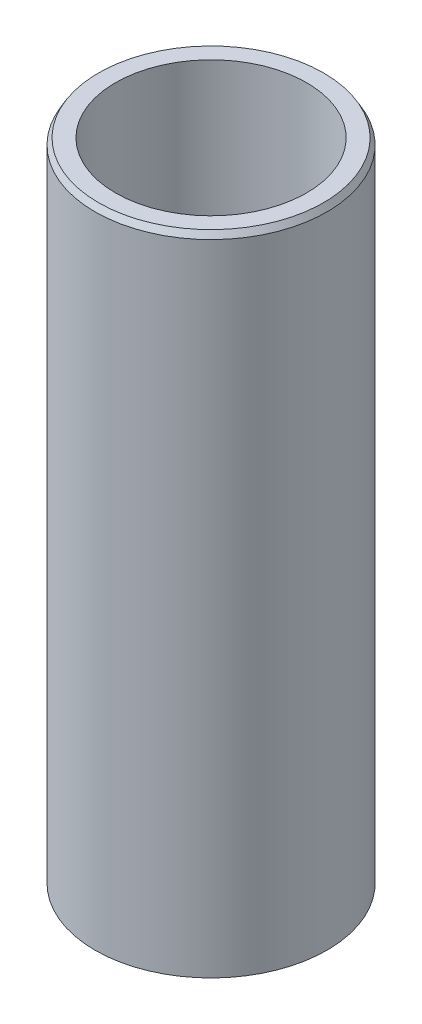
from build123d import *
from OCP.BRepFilletAPI import BRepFilletAPI_MakeChamfer

# Parameters (mm, degrees)
SKETCH1_R           = 52.5
BOSS_EXTRUDE1_DEPTH = 293.74974081
SKETCH2_R           = 43.245035952
CUT_EXTRUDE1_DEPTH  = 303.987475362
CHAMFER1_SIZE       = 2.775799468
CHAMFER1_SIZE2      = 1.60260857


with BuildPart() as part:
    # Sketch1 → Boss-Extrude1 (new body)
    with BuildSketch(Plane(origin=(0, 0, 0), x_dir=(1, 0, 0), z_dir=(0, 1, 0))):
        Circle(SKETCH1_R)
    extrude(amount=BOSS_EXTRUDE1_DEPTH)

    # Sketch2 → Cut-Extrude1 (cut, through all)
    with BuildSketch(Plane(origin=(0, 0, 0), x_dir=(1, 0, 0), z_dir=(0, 1, 0))):
        Circle(SKETCH2_R)
    extrude(amount=CUT_EXTRUDE1_DEPTH, mode=Mode.SUBTRACT)

    # Chamfer1: one chamfer whose edges measure the first distance from different faces: ONE call of the kernel's chamfer builder (chamfer() names one face for all edges)
    chamfer1_edges_1 = [part.edges().sort_by_distance(p)[0] for p in [
        (-52.5, 293.74974081, 0),
    ]]
    chamfer1_side_1 = [part.faces().sort_by_distance(p)[0] for p in [
        (-52.5, 146.874870405, 0),
    ]]
    chamfer1_edges_2 = [part.edges().sort_by_distance(p)[0] for p in [
        (-52.5, 0, 0),
    ]]
    chamfer1_side_2 = [part.faces().sort_by_distance(p)[0] for p in [
        (-51.01507576, 0, 0),
    ]]
    chamfer1 = BRepFilletAPI_MakeChamfer(part.part.solid().wrapped)
    for e in chamfer1_edges_1:
        chamfer1.Add(CHAMFER1_SIZE, CHAMFER1_SIZE2, e.wrapped, chamfer1_side_1[0].wrapped)  # the first distance lies on this face
    for e in chamfer1_edges_2:
        chamfer1.Add(CHAMFER1_SIZE, CHAMFER1_SIZE2, e.wrapped, chamfer1_side_2[0].wrapped)  # the first distance lies on this face
    add(Compound.cast(chamfer1.Shape()), mode=Mode.REPLACE)


solid = part.part
